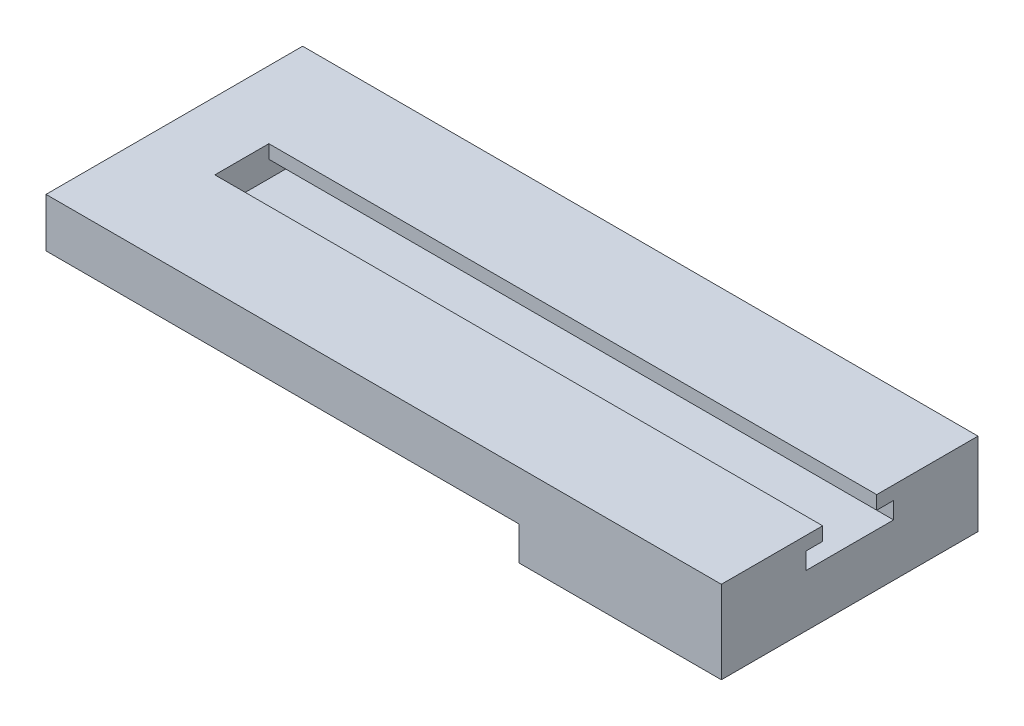
from build123d import *

# Parameters (mm, degrees)
BOSS_EXTRUDE1_DEPTH = 4
BOSS_EXTRUDE2_DEPTH = 5
BOSS_EXTRUDE3_START = -5
SKETCH3_W           = 200
SKETCH3_H           = 76
BOSS_EXTRUDE3_DEPTH = 5.5
BOSS_EXTRUDE4_START = -10.5
SKETCH4_W           = 60
SKETCH4_H           = 76
BOSS_EXTRUDE4_DEPTH = 10
CUT_EXTRUDE1_START  = -20.5
SKETCH5_R           = 10.5
CUT_EXTRUDE1_DEPTH  = 4


with BuildPart() as part:
    # Sketch1 → Boss-Extrude1 (new body)
    with BuildSketch(Plane(origin=(0, 0, 0), x_dir=(1, 0, 0), z_dir=(0, 1, 0))):
        Polygon((20, -16), (200, -16), (200, -46), (0, -46), (0, 30), (200, 30), (200, 0), (20, 0), align=None)
    extrude(amount=BOSS_EXTRUDE1_DEPTH)

    # Sketch2 → Boss-Extrude2 (add)
    with BuildSketch(Plane(origin=(0, 0, 0), x_dir=(1, 0, 0), z_dir=(0, 1, 0))):
        Polygon((200, 5), (200, 30), (0, 30), (0, -46), (200, -46), (200, -21), (20, -21), (20, 5), align=None)
    extrude(amount=-BOSS_EXTRUDE2_DEPTH)

    # Sketch3 → Boss-Extrude3 (add)
    with BuildSketch(Plane(origin=(0, 0, 0), x_dir=(1, 0, 0), z_dir=(0, 1, 0)).offset(BOSS_EXTRUDE3_START)):
        with Locations((100, -8)):
            Rectangle(SKETCH3_W, SKETCH3_H)
    extrude(amount=-BOSS_EXTRUDE3_DEPTH)

    # Sketch4 → Boss-Extrude4 (add)
    with BuildSketch(Plane(origin=(0, 0, 0), x_dir=(1, 0, 0), z_dir=(0, 1, 0)).offset(BOSS_EXTRUDE4_START)):
        with Locations((170, -8)):
            Rectangle(SKETCH4_W, SKETCH4_H)
    extrude(amount=-BOSS_EXTRUDE4_DEPTH)

    # Sketch5 → Cut-Extrude1 (cut)
    with BuildSketch(Plane(origin=(0, 0, 0), x_dir=(1, 0, 0), z_dir=(0, 1, 0)).offset(CUT_EXTRUDE1_START)):
        with Locations((170, -8)):
            Circle(SKETCH5_R)
    extrude(amount=CUT_EXTRUDE1_DEPTH, mode=Mode.SUBTRACT)


solid = part.part
